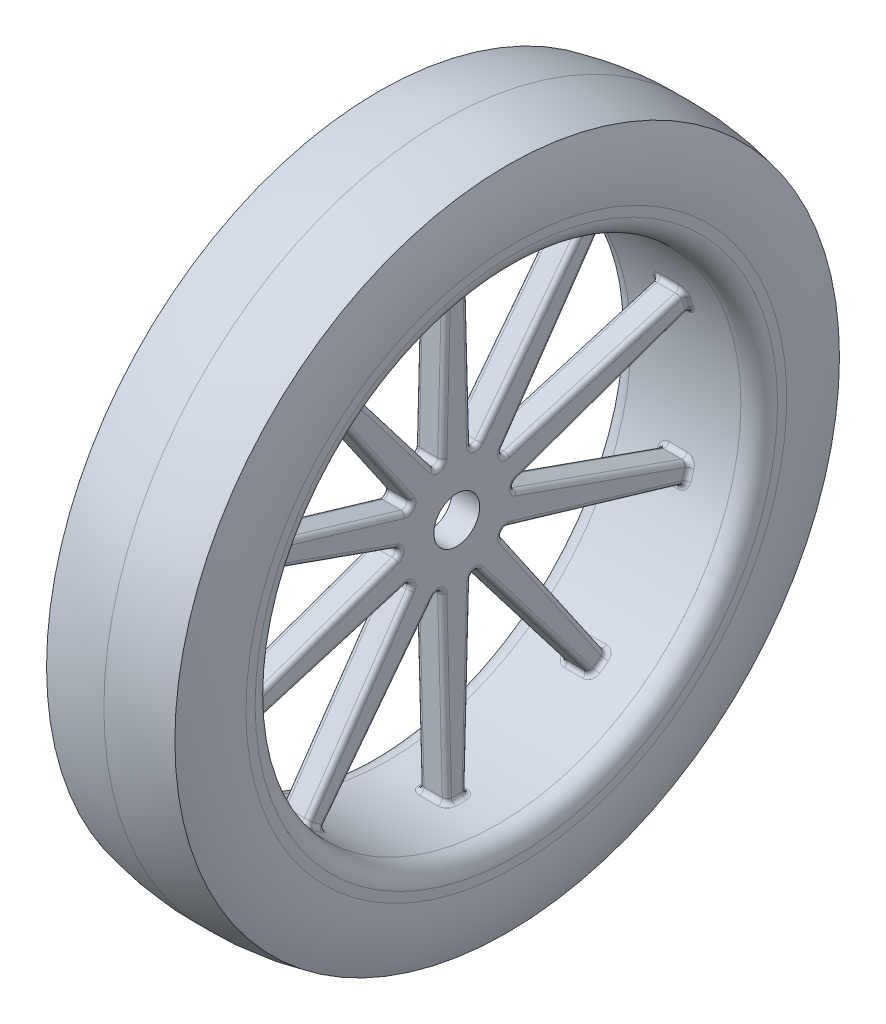
from build123d import *

# Parameters (mm, degrees)
BOSS_EXTRUDE1_DEPTH = 1.5
CIRPATTERN1_COUNT   = 10
FILLET1_R           = 0.5
FILLET3_R           = 0.5
SKETCH7_R           = 2.5
CUT_EXTRUDE1_DEPTH  = 1.5


# Read off the part's stored shape, not the designer's step: Revolve-Thin1
with BuildPart() as part:
    # Revolve-Thin1 outline → Revolve-Thin1 (revolve)
    with BuildSketch(Plane.YX):
        with BuildLine():
            Line((26.5, 6), (26.5, 0))
            Line((26.5, 0), (27.5, 0))
            Line((27.5, 0), (27.5, 6))
            ThreePointArc((27.5, 6), (27.792893219, 6.707106781), (28.5, 7))
            ThreePointArc((28.5, 7), (29.207106781, 7.292893219), (29.5, 8))
            Line((29.5, 8), (28.5, 8))
            ThreePointArc((28.5, 8), (27.085786438, 7.414213562), (26.5, 6))
        make_face()
    revolve(axis=Axis((0, 0, 0), (1, 0, 0)))

    # Sketch4 → Boss-Extrude1 (add)
    with BuildSketch(Plane(origin=(0, 0, 0), x_dir=(0, 0, -1), z_dir=(1, 0, 0))):
        Polygon((1.75, 0), (-1.75, 0), (-1.042980118, 27), (1.042980118, 27), align=None)
    boss_extrude1 = extrude(amount=BOSS_EXTRUDE1_DEPTH)

    # CirPattern1: Boss-Extrude1 ×10 about axis
    cirpattern1_axis = Axis((0, 0, 0), (1, 0, 0))
    for i in range(1, CIRPATTERN1_COUNT):
        add(boss_extrude1.rotate(cirpattern1_axis, i * 360 / CIRPATTERN1_COUNT))

    # Fillet1
    fillet1_edges = [part.edges().sort_by_distance(p)[0] for p in [
        (0.75, 3.08043912, -4.239860712),
        (0.75, 0, -5.240756055),
        (0.75, -3.08043912, -4.239860712),
        (0.75, -4.984255196, -1.619482684),
        (0.75, -4.984255196, 1.619482684),
        (0.75, -3.08043912, 4.239860712),
        (0.75, 0, 5.240756055),
        (0.75, 3.08043912, 4.239860712),
        (0.75, 4.984255196, 1.619482684),
        (0.75, 4.984255196, -1.619482684),
    ]]
    fillet(fillet1_edges, radius=FILLET1_R)

    # Fillet3
    fillet3_edges = [part.edges().sort_by_distance(p)[0] for p in [
        (0.75, -9.187348259, 24.856440452),
        (0.75, 7.177528248, 25.50947056),
        (0.75, 20.800832919, 16.418749949),
        (1.5, 26.494731079, -0.528417519),
        (0.75, 26.47892641, 1.05662491),
        (0.75, 26.47892641, -1.05662491),
        (1.5, -3.824424497, 16.040597671),
        (1.5, 3.824424497, 16.040597671),
        (1.5, -12.52245116, 10.729175798),
        (1.5, -6.334402337, 15.225056433),
        (1.5, -16.437327103, 1.319573442),
        (1.5, -14.073702777, 8.594061119),
        (1.5, -14.073702777, -8.594061119),
        (1.5, -16.437327103, -1.319573442),
        (1.5, -6.334402337, -15.225056433),
        (1.5, -12.52245116, -10.729175798),
        (1.5, 3.824424497, -16.040597671),
        (1.5, -3.824424497, -16.040597671),
        (1.5, 12.52245116, -10.729175798),
        (1.5, 6.334402337, -15.225056433),
        (1.5, 16.437327103, -1.319573442),
        (1.5, 14.073702777, -8.594061119),
        (1.5, 16.437327103, 1.319573442),
        (1.5, 14.073702777, 8.594061119),
        (1.5, 6.334402337, 15.225056433),
        (1.5, 12.52245116, 10.729175798),
        (1.5, 0, 6.238628211),
        (1.5, -3.666973657, 5.047156244),
        (1.5, -5.933288013, 1.927842139),
        (1.5, -5.933288013, -1.927842139),
        (1.5, -3.666973657, -5.047156244),
        (1.5, 0, -6.238628211),
        (1.5, 3.666973657, -5.047156244),
        (1.5, 5.933288013, -1.927842139),
        (1.5, 5.933288013, 1.927842139),
        (1.5, 3.666973657, 5.047156244),
        (0.75, 20.800832919, -16.418749949),
        (0.75, 7.177528248, -25.50947056),
        (0.75, -9.187348259, -24.856440452),
        (0.75, -22.042969997, -14.709094931),
        (0.75, -26.47892641, 1.05662491),
        (0.75, -20.800832919, 16.418749949),
        (0.75, -7.177528248, 25.50947056),
        (0.75, 9.187348259, 24.856440452),
        (0.75, 22.042969997, -14.709094931),
        (0.75, 22.042969997, 14.709094931),
        (1.5, -8.188950351, 25.202997682),
        (1.5, -21.438950351, 15.576309186),
        (1.5, -26.5, 0),
        (1.5, -21.438950351, -15.576309186),
        (1.5, -8.188950351, -25.202997682),
        (1.5, 8.188950351, -25.202997682),
        (1.5, 21.438950351, -15.576309186),
        (1.5, 21.438950351, 15.576309186),
        (1.5, 8.188950351, 25.202997682),
        (0.75, 9.187348259, -24.856440452),
        (0.75, -7.177528248, -25.50947056),
        (0.75, -20.800832919, -16.418749949),
        (0.75, -26.47892641, -1.05662491),
        (0.75, -22.042969997, 14.709094931),
    ]]
    fillet(fillet3_edges, radius=FILLET3_R)

    # Sketch7 → Cut-Extrude1 (cut)
    with BuildSketch(Plane(origin=(0, 0, 0), x_dir=(0, 0, -1), z_dir=(1, 0, 0))):
        with Locations(Location((0, 0, 0), (0, 0, 180))):
            Circle(SKETCH7_R)
    extrude(amount=CUT_EXTRUDE1_DEPTH, mode=Mode.SUBTRACT)

    # Mirror2 2: part across plane


with BuildPart() as body_2:
    # Sketch6 → Revolve1 (revolve)
    with BuildSketch(Plane.XY, mode=Mode.PRIVATE) as revolve1_sk:
        with BuildLine():
            Line((6, 27.5), (0, 27.5))
            Line((0, 27.5), (0, 37))
            ThreePointArc((0, 37), (3.523368416, 36.845969503), (7, 36.253615537))
            ThreePointArc((7, 36.253615537), (7.864389039, 32.93076243), (8, 29.5))
            ThreePointArc((8, 29.5), (7.292893219, 29.207106781), (7, 28.5))
            ThreePointArc((7, 28.5), (6.707106781, 27.792893219), (6, 27.5))
        make_face()
    revolve(revolve1_sk.sketch.rotate(Axis((0, 0, 0), (1, 0, 0)), 90), axis=Axis((0, 0, 0), (1, 0, 0)))

    # Mirror2: body 2 across plane


with BuildPart() as body_2_1:
    add(body_2.part)
    add(body_2.part.mirror(Plane(origin=(0, 0, 0), x_dir=(0, 0, 1), z_dir=(1, 0, 0))))


with BuildPart() as part_1:
    add(part.part)
    add(part.part.mirror(Plane(origin=(0, 0, 0), x_dir=(0, 0, 1), z_dir=(1, 0, 0))))


solid = Compound([body_2_1.part, part_1.part])
